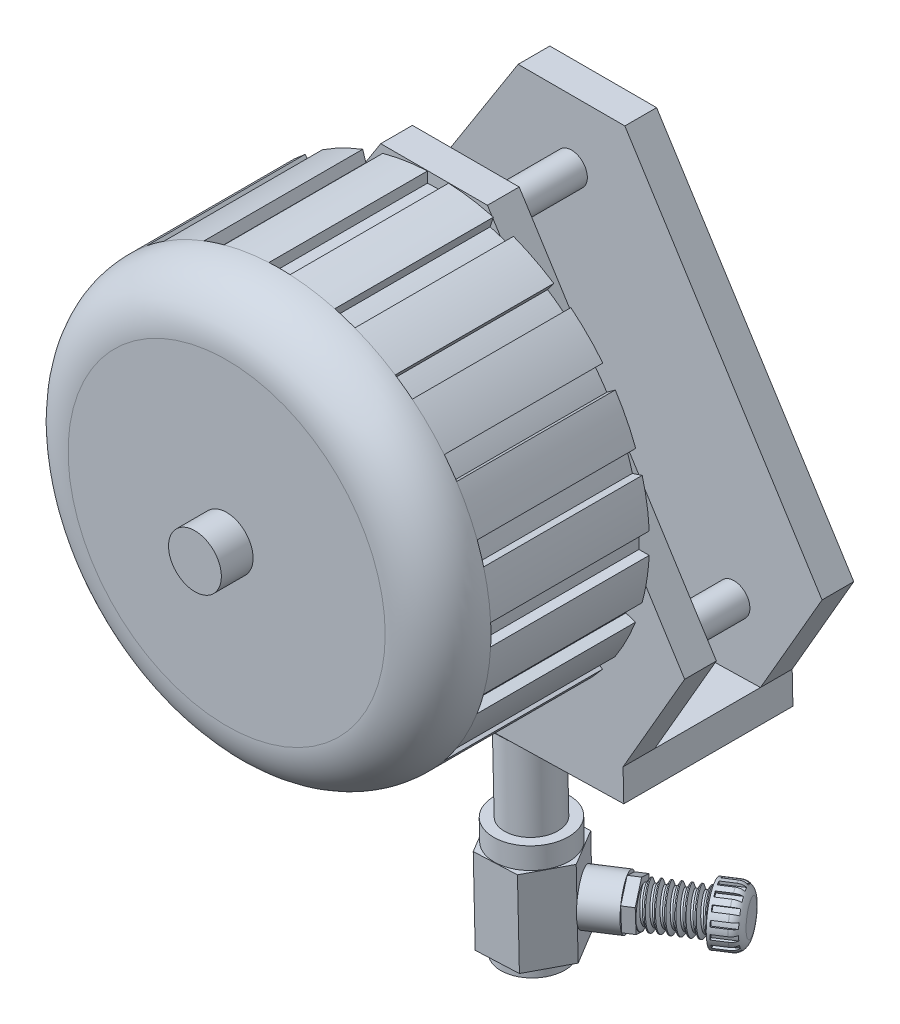
from build123d import *

# Parameters (mm, degrees)
SKETCH1_R            = 20
BOSS_EXTRUDE1_DEPTH  = 20
FILLET1_R            = 5
SKETCH2_R            = 2.5
BOSS_EXTRUDE2_DEPTH  = 3
CUT_EXTRUDE2_DEPTH   = 15
CIRPATTERN1_COUNT    = 20
BOSS_EXTRUDE3_DEPTH  = 3
SKETCH6_R            = 1.5
BOSS_EXTRUDE4_DEPTH  = 10
BOSS_EXTRUDE5_DEPTH  = 3
SKETCH9_R            = 7.5
SKETCH9_R_2          = 5
BOSS_EXTRUDE6_DEPTH  = 5
SKETCH10_W           = 34.950827193
SKETCH10_H           = 16
BOSS_EXTRUDE7_DEPTH  = 3
BOSS_EXTRUDE8_DEPTH  = 3
SKETCH14_R           = 2.5
BOSS_EXTRUDE9_DEPTH  = 10
SKETCH15_R           = 3.5
BOSS_EXTRUDE10_DEPTH = 2
BOSS_EXTRUDE11_DEPTH = 8
SKETCH17_R           = 3
SKETCH17_R_2         = 2.5
BOSS_EXTRUDE12_DEPTH = 1
SKETCH18_R           = 2.25
BOSS_EXTRUDE13_DEPTH = 3
BOSS_EXTRUDE14_DEPTH = 1
SKETCH20_R           = 1.5
BOSS_EXTRUDE15_DEPTH = 5
THREAD1_PITCH        = 0.7
SKETCH26_W           = 11.93078903
SKETCH26_H           = 9.747435377
CUT_EXTRUDE3_DEPTH   = 10
SKETCH27_R           = 2.5
BOSS_EXTRUDE16_DEPTH = 2.5
FILLET3_R            = 1
CUT_EXTRUDE4_START   = -2.25
CUT_EXTRUDE4_DEPTH   = 2.25
CIRPATTERN2_COUNT    = 15


with BuildPart() as part:
    # Sketch1 → Boss-Extrude1 (new body)
    with BuildSketch(Plane.XY):
        Circle(SKETCH1_R)
    extrude(amount=BOSS_EXTRUDE1_DEPTH)

    # Fillet1
    fillet1_edges = [part.edges().sort_by_distance(p)[0] for p in [
        (-20, 0, 20),
    ]]
    fillet(fillet1_edges, radius=FILLET1_R)

    # Sketch2 → Boss-Extrude2 (add)
    with BuildSketch(Plane.XY.offset(20)):
        Circle(SKETCH2_R)
    extrude(amount=BOSS_EXTRUDE2_DEPTH)

    # Sketch3 → Cut-Extrude2 (cut)
    with BuildSketch(Plane(origin=(0, 0, 0), x_dir=(-1, 0, 0), z_dir=(0, 0, -1))):
        with BuildLine():
            Line((0, 20.333826553), (-1, 20.333826553))
            Line((-1, 20.333826553), (-1, 18.973665961))
            ThreePointArc((-1, 18.973665961), (0, 19), (1, 18.973665961))
            Line((1, 18.973665961), (1, 20.333826553))
            Line((1, 20.333826553), (0, 20.333826553))
        make_face()
    cut_extrude2 = extrude(amount=-CUT_EXTRUDE2_DEPTH, mode=Mode.SUBTRACT)

    # CirPattern1: Cut-Extrude2 ×20 about axis
    cirpattern1_axis = Axis((0, -0.031084708, 0), (0, 0, 1))
    for i in range(1, CIRPATTERN1_COUNT):
        add(cut_extrude2.rotate(cirpattern1_axis, i * 360 / CIRPATTERN1_COUNT), mode=Mode.SUBTRACT)

    # Sketch5 → Boss-Extrude3 (add)
    with BuildSketch(Plane(origin=(0, 0, 0), x_dir=(-1, 0, 0), z_dir=(0, 0, -1))):
        Polygon((5.425817157, 20), (0, 20), (-4.671503696, 20), (-23.326037065, -9.507136068), (-17.499931775, -19.592299942), (0, -20), (17.495252771, -20.40759105), (24.249443828, -9.507136068), align=None)
    extrude(amount=BOSS_EXTRUDE3_DEPTH)

    # Sketch6 → Boss-Extrude4 (add)
    with BuildSketch(Plane(origin=(0, 0, -3), x_dir=(-1, 0, 0), z_dir=(0, 0, -1))):
        with Locations((-14.999931775, -13.592299942)):
            Circle(SKETCH6_R)
        with Locations((14.995252771, -14.40759105)):
            Circle(SKETCH6_R)
        with Locations((0.37715673, 14)):
            Circle(SKETCH6_R)
    extrude(amount=BOSS_EXTRUDE4_DEPTH)

    # Sketch7 → Boss-Extrude5 (add)
    with BuildSketch(Plane(origin=(0, 0, -13), x_dir=(-1, 0, 0), z_dir=(0, 0, -1))):
        Polygon((-17.499931775, -19.592299942), (-23.326037065, -9.507136068), (-4.671503696, 20), (5.425817157, 20), (24.249443828, -9.507136068), (17.495252771, -20.40759105), align=None)
    extrude(amount=BOSS_EXTRUDE5_DEPTH)

    # Sketch9 → Boss-Extrude6 (add)
    with BuildSketch(Plane(origin=(0, 0, -16), x_dir=(-1, 0, 0), z_dir=(0, 0, -1))):
        Circle(SKETCH9_R)
        Circle(SKETCH9_R_2, mode=Mode.SUBTRACT)
    extrude(amount=BOSS_EXTRUDE6_DEPTH)

    # Sketch10 → Boss-Extrude7 (add)
    with BuildSketch(Plane(origin=(0.46569198, -19.989150664, 0), x_dir=(0.9997287297960256, 0.023290917122890588, 0), z_dir=(0.023290917122890588, -0.9997287297960257, 0))):
        with Locations((-0.436551666, -8)):
            Rectangle(SKETCH10_W, SKETCH10_H)
    extrude(amount=BOSS_EXTRUDE7_DEPTH)

    # Sketch11 → Boss-Extrude8 (add)
    with BuildSketch(Plane(origin=(0.535564731, -22.988336853, 0), x_dir=(0.9997287297960256, 0.02329091712289059, 0), z_dir=(0.02329091712289059, -0.9997287297960257, 0))):
        Polygon((2.962802483, -3.044686208), (-2.810026386, -2.956480887), (-5.772828869, -7.911794679), (-2.962802483, -12.955313792), (2.810026386, -13.043519113), (5.772828869, -8.088205321), align=None)
    boss_extrude8 = extrude(amount=BOSS_EXTRUDE8_DEPTH)

    # Mirror1: Boss-Extrude8 across plane
    add(boss_extrude8.mirror(Plane(origin=(0.500628356, -21.488743758, 0), x_dir=(0, 0, 1), z_dir=(0.02329091712289059, -0.9997287297960257, 0))))

    # Sketch14 → Boss-Extrude9 (add)
    with BuildSketch(Plane(origin=(0.605437483, -25.987523042, 0), x_dir=(0.9997287297960256, 0.023290917122890595, 0), z_dir=(0.023290917122890595, -0.9997287297960257, 0))):
        with Locations((0, -8)):
            Circle(SKETCH14_R)
    extrude(amount=BOSS_EXTRUDE9_DEPTH)

    # Sketch15 → Boss-Extrude10 (add)
    with BuildSketch(Plane(origin=(0.838346654, -35.98481034, 0), x_dir=(-0.9997287297960256, -0.023290917122890598, 0), z_dir=(0.023290917122890598, -0.9997287297960257, 0))):
        with Locations(Location((0, 8, 0), (0, 0, 180))):
            Circle(SKETCH15_R)
    extrude(amount=BOSS_EXTRUDE10_DEPTH)

    # Sketch16 → Boss-Extrude11 (add)
    with BuildSketch(Plane(origin=(0.884928488, -37.9842678, 0), x_dir=(-0.9997287297960256, -0.0232909171228906, 0), z_dir=(0.0232909171228906, -0.9997287297960257, 0))):
        Polygon((-2.124940893, 4.5), (1.968618467, 4.409747205), (4.09355936, 7.909747205), (2.124940893, 11.5), (-1.968618467, 11.590252795), (-4.09355936, 8.090252795), align=None)
    extrude(amount=BOSS_EXTRUDE11_DEPTH)

    # Sketch17 → Boss-Extrude12 (add)
    with BuildSketch(Plane(origin=(1.071255825, -45.982097638, 0), x_dir=(0.9997287297960256, 0.023290917122891545, 0), z_dir=(0.023290917122891545, -0.9997287297960257, 1.3761201724432384e-15))):
        with Locations((0, -7.909747205)):
            Circle(SKETCH17_R)
        with Locations((0, -7.909747205)):
            Circle(SKETCH17_R_2, mode=Mode.SUBTRACT)
    extrude(amount=BOSS_EXTRUDE12_DEPTH)

    # Sketch18 → Boss-Extrude13 (add)
    with BuildSketch(Plane(origin=(6.578186661, 0.153253573, -3.994871643), x_dir=(-0.5188268062541653, -0.012087231051232432, -0.8547939189989696), z_dir=(0.8545620388782067, 0.019908934324555688, -0.5189675866972648))):
        with Locations(Location((6.838351352, -41.994574596, 0), (0, 0, 204.50833628))):
            Circle(SKETCH18_R)
    extrude(amount=BOSS_EXTRUDE13_DEPTH)

    # Sketch19 → Boss-Extrude14 (add)
    with BuildSketch(Plane(origin=(9.141872778, 0.212980376, -5.551774403), x_dir=(-0.5188268062541654, -0.012087231051232434, -0.8547939189989695), z_dir=(0.8545620388782066, 0.01990893432455569, -0.518967586697265))):
        Polygon((8.735209645, -40.784438811), (6.738772167, -39.746779235), (4.841913874, -40.956915019), (4.941493059, -43.20471038), (6.937930537, -44.242369957), (8.83478883, -43.032234173), align=None)
    extrude(amount=BOSS_EXTRUDE14_DEPTH)

    # Sketch20 → Boss-Extrude15 (add)
    with BuildSketch(Plane(origin=(9.996434817, 0.232889311, -6.07074199), x_dir=(-0.5188268062541647, -0.012087231051231823, -0.8547939189989701), z_dir=(0.8545620388782071, 0.019908934324554737, -0.5189675866972642))):
        with Locations(Location((6.838351352, -41.994574596, 0), (0, 0, 0.692701492))):
            Circle(SKETCH20_R)
    extrude(amount=BOSS_EXTRUDE15_DEPTH)

    # Thread1: the profile of Thread Profile1 profile screwed along a right-hand helix of 14.285714 turns, 6 arcs to a turn; built about Z, then put on its axis
    thread1_z = Axis((0, 0, 0), (0, 0, 1))
    thread1_corners = [(1.4997, 0, -0.000173204), (1.878886113, 0, 0.21875), (1.878886113, 0, 0.30625), (1.4997, 0, 0.525173204)]
    with BuildLine(mode=Mode.PRIVATE) as thread1_profile:
        Line(thread1_corners[0], thread1_corners[1])
        Line(thread1_corners[1], thread1_corners[2])
        Line(thread1_corners[2], thread1_corners[3])
        Line(thread1_corners[3], thread1_corners[0])
    thread1_cap = Face(thread1_profile.wire())
    thread1_turn_angles = [0, 30, 60, 90, 120, 150, 180, 210, 240, 270, 300, 330, 360]
    thread1_turn_weights = [1, 0.8660254037844387, 1, 0.8660254037844387, 1, 0.8660254037844387, 1, 0.8660254037844387, 1, 0.8660254037844387, 1, 0.8660254037844387, 1]
    thread1_turn_rails = [Edge.make_bspline([Vector(p[0], p[1], 0).rotate(thread1_z, thread1_turn_angles[k]) / thread1_turn_weights[k] + Vector(0, 0, p[2] + THREAD1_PITCH * thread1_turn_angles[k] / 360) for k in range(13)], [0, 0, 0, 1, 1, 2, 2, 3, 3, 4, 4, 5, 5, 6, 6, 6], 2, thread1_turn_weights) for p in thread1_corners]
    thread1_turn_sides = [Face.make_surface_from_curves(thread1_turn_rails[p[0]], thread1_turn_rails[p[1]]) for p in [(0, 1), (1, 2), (2, 3), (3, 0)]]
    thread1_last_angles = [5040, 5070, 5100, 5121.428571429, 5142.857142857]
    thread1_last_weights = [1, 0.8660254037844387, 1, 0.9308737486442035, 1]
    thread1_last_rails = [Edge.make_bspline([Vector(p[0], p[1], 0).rotate(thread1_z, thread1_last_angles[k]) / thread1_last_weights[k] + Vector(0, 0, p[2] + THREAD1_PITCH * thread1_last_angles[k] / 360) for k in range(5)], [0, 0, 0, 1, 1, 2, 2, 2], 2, thread1_last_weights) for p in thread1_corners]
    thread1_last_sides = [Face.make_surface_from_curves(thread1_last_rails[p[0]], thread1_last_rails[p[1]]) for p in [(0, 1), (1, 2), (2, 3), (3, 0)]]
    thread1 = Plane(origin=(15.97222737, -41.633860798, -17.105799009), x_dir=(0.518826806, 0.012087231, 0.854793919), z_dir=(-0.854562039, -0.019908934, 0.518967587)) * Solid(Shell([*[p.moved(Location((0, 0, THREAD1_PITCH * i))) for i in range(14) for p in thread1_turn_sides], *thread1_last_sides, thread1_cap, thread1_cap.rotate(thread1_z, 5142.857142857).moved(Location((0, 0, THREAD1_PITCH * 5142.857142857 / 360)))]))
    add(thread1)

    # Sketch26 → Cut-Extrude3 (cut)
    with BuildSketch(Plane(origin=(14.269245011, 0.332433982, -8.665579923), x_dir=(-0.5188268062541649, -0.012087231051231837, -0.85479391899897), z_dir=(0.854562038878207, 0.019908934324554744, -0.5189675866972643))):
        with Locations((6.838351352, -41.835571417)):
            Rectangle(SKETCH26_W, SKETCH26_H)
    extrude(amount=CUT_EXTRUDE3_DEPTH, mode=Mode.SUBTRACT)

    # Sketch27 → Boss-Extrude16 (add)
    with BuildSketch(Plane(origin=(14.269245011, 0.332433982, -8.665579923), x_dir=(-0.5188268062541649, -0.012087231051231837, -0.85479391899897), z_dir=(0.854562038878207, 0.019908934324554744, -0.5189675866972643))):
        with Locations(Location((6.838351352, -41.994574596, 0), (0, 0, 0.692701492))):
            Circle(SKETCH27_R)
    extrude(amount=BOSS_EXTRUDE16_DEPTH)

    # Fillet3
    fillet3_edges = [part.edges().sort_by_distance(p)[0] for p in [
        (15.133498442, -41.683633134, -13.67155142),
    ]]
    fillet(fillet3_edges, radius=FILLET3_R)

    # Sketch28 → Cut-Extrude4 (cut)
    with BuildSketch(Plane(origin=(16.405650108, 0.382206318, -9.96299889), x_dir=(-0.5188268062541649, -0.01208723105123184, -0.85479391899897), z_dir=(0.854562038878207, 0.019908934324554747, -0.5189675866972643)).offset(CUT_EXTRUDE4_START)):
        with BuildLine():
            Line((6.838351352, -39.40948405), (7.067903387, -39.40948405))
            Line((7.067903387, -39.40948405), (7.067903387, -39.756315035))
            ThreePointArc((7.067903387, -39.756315035), (6.828068815, -39.744598092), (6.588351352, -39.758506618))
            Line((6.588351352, -39.758506618), (6.588351352, -39.40948405))
            Line((6.588351352, -39.40948405), (6.838351352, -39.40948405))
        make_face()
    cut_extrude4 = extrude(amount=CUT_EXTRUDE4_DEPTH, mode=Mode.SUBTRACT)

    # CirPattern2: Cut-Extrude4 ×15 about axis
    cirpattern2_axis = Axis((-2.569827835, -42.065839452, -5.845381152), (0.854562038878207, 0.019908934324554747, -0.5189675866972643))
    for i in range(1, CIRPATTERN2_COUNT):
        add(cut_extrude4.rotate(cirpattern2_axis, i * 360 / CIRPATTERN2_COUNT), mode=Mode.SUBTRACT)


solid = part.part
